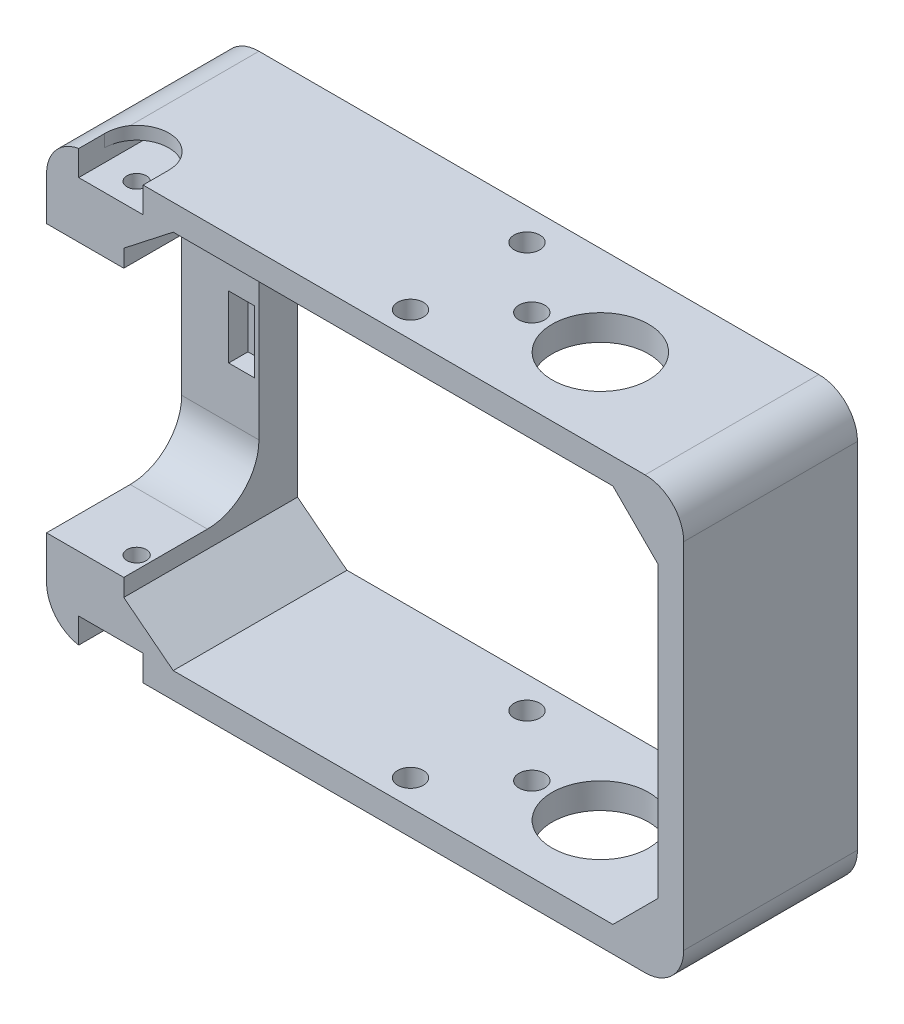
from build123d import *

# Parameters (mm, degrees)
SALIENTE_EXTRUIR1_DEPTH      = 3
SALIENTE_EXTRUIR1_DEPTH_BACK = 24
CROQUIS1_W                   = 99
CROQUIS1_H                   = 67
CROQUIS1_W_2                 = 83
CROQUIS1_H_2                 = 59
CHAFL_N1_SIZE                = 6
CHAFL_N1_SIZE2               = 7.679649793
CROQUIS10_R                  = 1.5
CORTAR_EXTRUIR6_DEPTH        = 97.317236256
CORTAR_EXTRUIR1_DEPTH        = 2
CORTAR_EXTRUIR2_REACH        = 117.178
REDONDEO3_R                  = 6
CROQUIS12_R                  = 7.5
CROQUIS12_R_2                = 2
CORTAR_EXTRUIR7_DEPTH        = 70
CHAFL_N2_SIZE                = 7
CROQUIS16_W                  = 10
CROQUIS16_H                  = 2
CORTAR_EXTRUIR9_DEPTH        = 89.48769705
CROQUIS17_W                  = 4
CROQUIS17_H                  = 9.7
CORTAR_EXTRUIR10_DEPTH       = 3


with BuildPart() as part:
    # Croquis1 → Saliente-Extruir1 (new, two sides: drawn at the far end of the back side and taken through both)
    with BuildSketch(Plane.XY.offset(-SALIENTE_EXTRUIR1_DEPTH_BACK)):
        with Locations((-15.4, 20.25)):
            Rectangle(CROQUIS1_W, CROQUIS1_H)
        with Locations((-11.4, 20.25)):
            Rectangle(CROQUIS1_W_2, CROQUIS1_H_2, mode=Mode.SUBTRACT)
    extrude(amount=SALIENTE_EXTRUIR1_DEPTH + SALIENTE_EXTRUIR1_DEPTH_BACK)

    # Chaflán1
    chafl_n1_edges = [part.edges().sort_by_distance(p)[0] for p in [
        (-52.9, 49.75, -10.5),
        (-52.9, -9.25, -10.5),
    ]]
    chafl_n1_side = [part.faces().sort_by_distance(p)[0] for p in [
        (-52.9, 20.25, -10.5),
    ]]
    chamfer(chafl_n1_edges, length=CHAFL_N1_SIZE, length2=CHAFL_N1_SIZE2, reference=chafl_n1_side[0])

    # Croquis10 → Cortar-Extruir6 (cut, through all)
    with BuildSketch(Plane(origin=(0, 53.75, 0), x_dir=(1, 0, 0), z_dir=(0, 1, 0))):
        with Locations((-54.9, 1)):
            Circle(CROQUIS10_R)
    extrude(amount=-CORTAR_EXTRUIR6_DEPTH, mode=Mode.SUBTRACT)

    # Croquis2 → Cortar-Extruir1 (cut)
    with BuildSketch(Plane(origin=(0, -13.25, 0), x_dir=(-1, 0, 0), z_dir=(0, -1, 0))):
        with BuildLine():
            Line((49.9, 1), (49.9, -3))
            Line((49.9, -3), (59.9, -3))
            Line((59.9, -3), (59.9, 1))
            ThreePointArc((59.9, 1), (54.9, 6), (49.9, 1))
        make_face()
    cortar_extruir1 = extrude(amount=-CORTAR_EXTRUIR1_DEPTH, mode=Mode.SUBTRACT)

    # Croquis5 → Cortar-Extruir2 (cut, up to next)
    with BuildSketch(Plane.ZY.offset(64.9), mode=Mode.PRIVATE) as cortar_extruir2_sk1:
        with BuildLine():
            Line((-18, 33.05), (-18, 7.45))
            ThreePointArc((-18, 7.45), (-15.656854249, 1.793145751), (-10, -0.55))
            Line((-10, -0.55), (3, -0.55))
            Line((3, -0.55), (3, 41.05))
            Line((3, 41.05), (-10, 41.05))
            ThreePointArc((-10, 41.05), (-15.656854249, 38.706854249), (-18, 33.05))
        make_face()
    cortar_extruir2_tool1 = extrude(cortar_extruir2_sk1.sketch, amount=-CORTAR_EXTRUIR2_REACH, mode=Mode.PRIVATE) & part.part
    add(cortar_extruir2_tool1.solids().sort_by_distance((-64.9, 20.25, -7.217137))[0], mode=Mode.SUBTRACT)

    # Redondeo3
    redondeo3_edges = [part.edges().sort_by_distance(p)[0] for p in [
        (34.1, -13.25, -10.5),
        (34.1, 53.75, -10.5),
        (-64.9, -13.25, -10.5),
        (-64.9, 53.75, -10.5),
    ]]
    fillet(redondeo3_edges, radius=REDONDEO3_R)

    # Croquis12 → Cortar-Extruir7 (cut)
    with BuildSketch(Plane.XZ.offset(13.25)):
        with Locations((8.1, -10.05)):
            Circle(CROQUIS12_R)
        with Locations((-12.35, -1)):
            Circle(CROQUIS12_R_2)
        with Locations((-12.35, -19.1)):
            Circle(CROQUIS12_R_2)
        with Locations((-2.55, -10.05)):
            Circle(CROQUIS12_R_2)
    extrude(amount=-CORTAR_EXTRUIR7_DEPTH, mode=Mode.SUBTRACT)

    # Chaflán2
    chafl_n2_edges = [part.edges().sort_by_distance(p)[0] for p in [
        (30.1, 49.75, -10.5),
        (30.1, -9.25, -10.5),
    ]]
    chamfer(chafl_n2_edges, length=CHAFL_N2_SIZE)

    # Simetría2: Cortar-Extruir1 across plane
    add(cortar_extruir1.mirror(Plane(origin=(0, 20.25, 0), x_dir=(0, 0, 1), z_dir=(0, -1, 0))), mode=Mode.SUBTRACT)

    # Croquis16 → Cortar-Extruir9 (cut, through all)
    with BuildSketch(Plane.XY.offset(3)):
        with Locations((-54.9, -10.25)):
            Rectangle(CROQUIS16_W, CROQUIS16_H)
        with Locations((-54.9, 50.75)):
            Rectangle(CROQUIS16_W, CROQUIS16_H)
    extrude(amount=-CORTAR_EXTRUIR9_DEPTH, mode=Mode.SUBTRACT)

    # Croquis17 → Cortar-Extruir10 (cut)
    with BuildSketch(Plane.XY.offset(-18)):
        with Locations((-55.6, 20.3)):
            Rectangle(CROQUIS17_W, CROQUIS17_H)
    extrude(amount=-CORTAR_EXTRUIR10_DEPTH, mode=Mode.SUBTRACT)


solid = part.part
